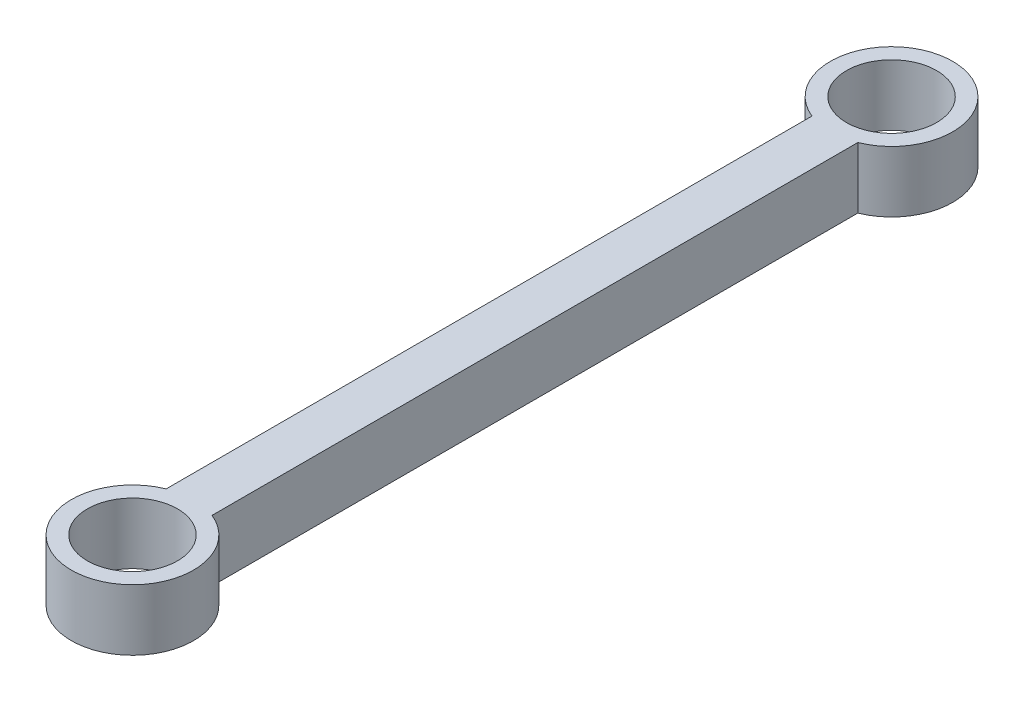
from build123d import *

# Parameters (mm, degrees)
SKETCH1_R           = 2.95
BOSS_EXTRUDE1_DEPTH = 4


with BuildPart() as part:
    # Sketch1 → Boss-Extrude1 (new body)
    with BuildSketch(Plane(origin=(0, 0, 0), x_dir=(1, 0, 0), z_dir=(0, 1, 0))):
        with BuildLine():
            Line((-1.5, 45.961900756), (-1.5, 3.708099244))
            ThreePointArc((-1.5, 3.708099244), (0, -4), (1.5, 3.708099244))
            Line((1.5, 3.708099244), (1.5, 45.961900756))
            ThreePointArc((1.5, 45.961900756), (0, 53.67), (-1.5, 45.961900756))
        make_face()
        with Locations((0, 49.67)):
            Circle(SKETCH1_R, mode=Mode.SUBTRACT)
        Circle(SKETCH1_R, mode=Mode.SUBTRACT)
    extrude(amount=BOSS_EXTRUDE1_DEPTH)


solid = part.part
